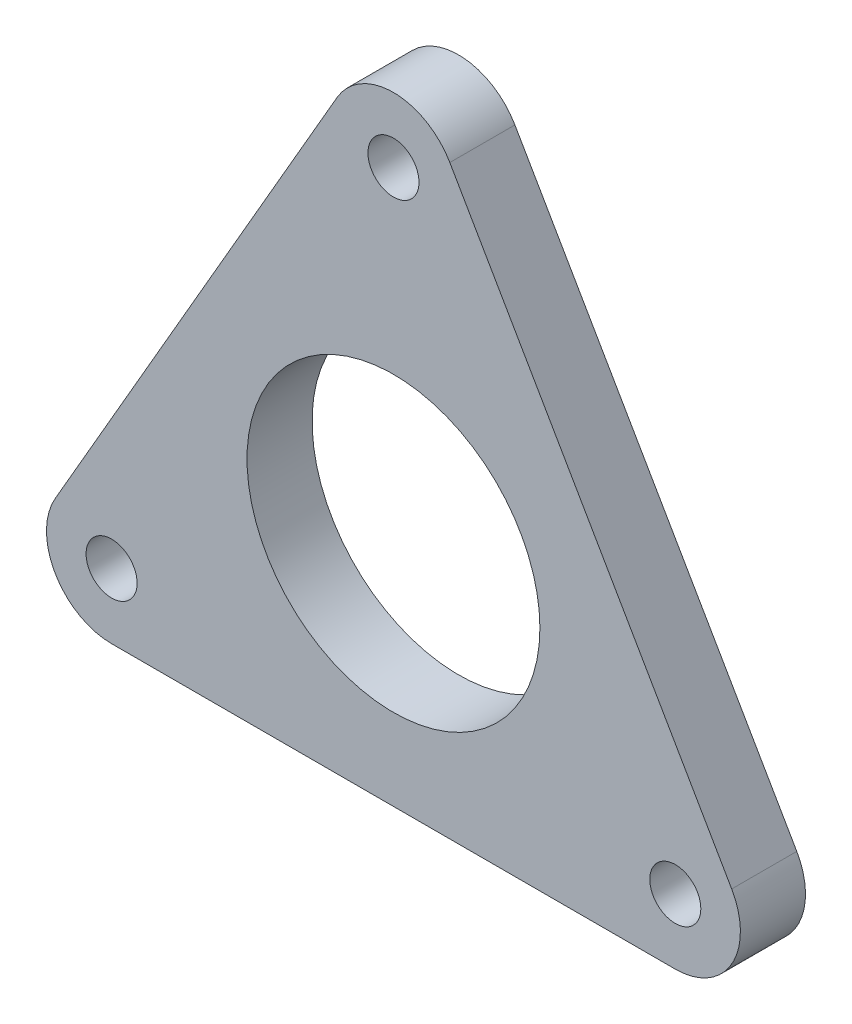
from build123d import *

# Parameters (mm, degrees)
SKETCH2_R           = 2.4892
SKETCH2_R_2         = 14.2875
BOSS_EXTRUDE1_DEPTH = 6.35
FILLET1_R           = 6.35


with BuildPart() as part:
    # Sketch2 → Boss-Extrude1 (new body)
    with BuildSketch(Plane.XY):
        Polygon((38.494829198, -22.225), (0, 44.45), (-38.494829198, -22.225), align=None)
        with Locations((-27.49630657, -15.875)):
            Circle(SKETCH2_R, mode=Mode.SUBTRACT)
        with Locations((27.49630657, -15.875)):
            Circle(SKETCH2_R, mode=Mode.SUBTRACT)
        Circle(SKETCH2_R_2, mode=Mode.SUBTRACT)
        with Locations((0, 31.75)):
            Circle(SKETCH2_R, mode=Mode.SUBTRACT)
    extrude(amount=BOSS_EXTRUDE1_DEPTH)

    # Fillet1
    fillet1_edges = [part.edges().sort_by_distance(p)[0] for p in [
        (38.494829198, -22.225, 3.175),
        (-38.494829198, -22.225, 3.175),
        (0, 44.45, 3.175),
    ]]
    fillet(fillet1_edges, radius=FILLET1_R)


solid = part.part
